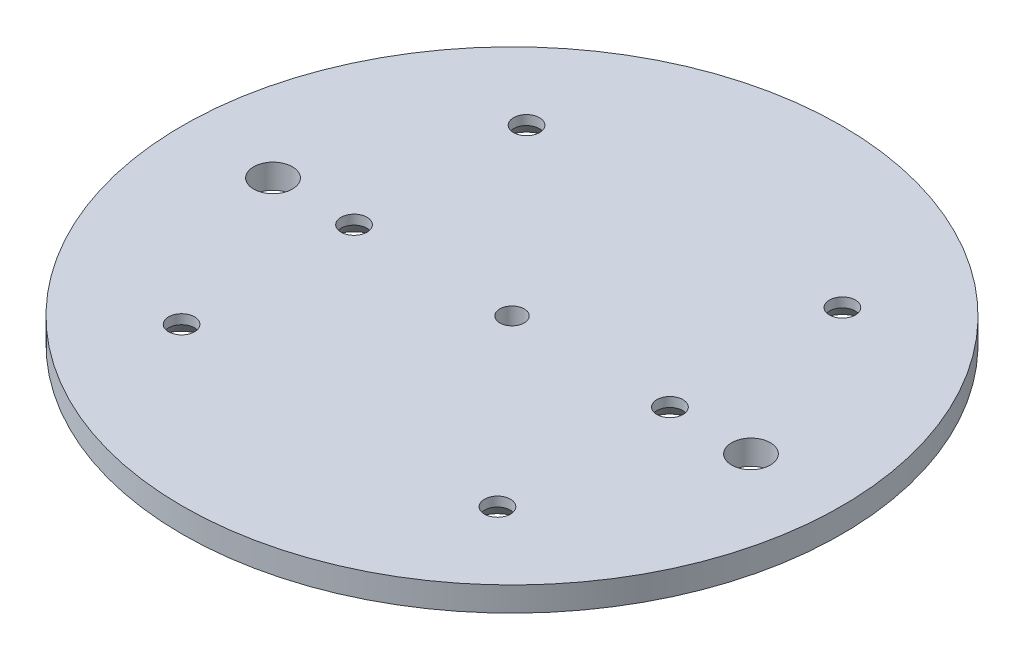
from build123d import *

# Parameters (mm, degrees)
SKETCH1_R                                    = 85.725
BOSS_EXTRUDE1_DEPTH                          = 6.35
F_3_8_CLEARANCE_HOLE1_D                      = 10.0838
F_1_4_0_25_CLEARANCE_DOWEL_HOLE1_D           = 6.35
CSK_FOR_1_4_FLAT_HEAD_SOCKET_CAP_SCR_2_COUNT = 2
CSK_FOR_1_4_FLAT_HEAD_SOCKET_CAP_SCR_2_PITCH = 89.726645959
CSK_FOR_1_4_FLAT_HEAD_SOCKET_CAP_SCR_3_COUNT = 2
CSK_FOR_1_4_FLAT_HEAD_SOCKET_CAP_SCR_3_PITCH = 44.863322979
CSK_FOR_1_4_FLAT_HEAD_SOCKET_CAP_SCR_4_COUNT = 2
CSK_FOR_1_4_FLAT_HEAD_SOCKET_CAP_SCR_4_PITCH = 82.169
CSK_FOR_1_4_FLAT_HEAD_SOCKET_CAP_SCR_5_COUNT = 2
CSK_FOR_1_4_FLAT_HEAD_SOCKET_CAP_SCR_5_PITCH = 93.61870705
CSK_FOR_1_4_FLAT_HEAD_SOCKET_CAP_SCR_6_COUNT = 2
CSK_FOR_1_4_FLAT_HEAD_SOCKET_CAP_SCR_6_PITCH = 121.666


with BuildPart() as part:
    # Sketch1 → Boss-Extrude1 (new body)
    with BuildSketch(Plane(origin=(0, 0, 0), x_dir=(1, 0, 0), z_dir=(0, 1, 0))):
        Circle(SKETCH1_R)
    extrude(amount=BOSS_EXTRUDE1_DEPTH)

    # 3/8 Clearance Hole1 (through all)
    with Locations(Plane(origin=(0, 6.35, 0), x_dir=(0.9997060077974086, 0, 0.024246607469250614), z_dir=(0, 1, 0))):
        with Locations((-62.148223534, -1.507326723), (62.148223534, 1.507326723)):
            Hole(F_3_8_CLEARANCE_HOLE1_D / 2)

    # 1/4 (0.25) Clearance Dowel Hole1 (through all)
    with Locations(Plane(origin=(43.377433792, 6.35, -259.284531313), x_dir=(0.9888467421616725, 0, -0.14893663255306588), z_dir=(0, 1, 0))):
        with Locations((-81.510599056, -249.932175164)):
            Hole(F_1_4_0_25_CLEARANCE_DOWEL_HOLE1_D / 2)

    # Sketch11 → CSK for 1/4 Flat Head Socket Cap Screw1 (revolve, cut)
    with BuildSketch(Plane(origin=(41.0845, 0, -44.863322979), x_dir=(0, 0, -1), z_dir=(1, 0, 0))):
        Polygon((0, 0), (0, 6.35), (3.3782, 6.35), (3.3782, 3.871564875), (6.7437, 0), align=None)
    csk_for_1_4_flat_head_socket_cap_screw1 = revolve(axis=Axis((41.0845, -6.35, -44.863322979), (0, 1, 0)), mode=Mode.SUBTRACT)

    # CSK for 1_4 Flat Head Socket Cap Scr 2: CSK for 1/4 Flat Head Socket Cap Screw1 ×2
    with Locations(*[(0, 0, i * CSK_FOR_1_4_FLAT_HEAD_SOCKET_CAP_SCR_2_PITCH) for i in range(1, CSK_FOR_1_4_FLAT_HEAD_SOCKET_CAP_SCR_2_COUNT)]):
        add(csk_for_1_4_flat_head_socket_cap_screw1, mode=Mode.SUBTRACT)

    # CSK for 1_4 Flat Head Socket Cap Scr 3: CSK for 1/4 Flat Head Socket Cap Screw1 ×2
    with Locations(*[(0, 0, i * CSK_FOR_1_4_FLAT_HEAD_SOCKET_CAP_SCR_3_PITCH) for i in range(1, CSK_FOR_1_4_FLAT_HEAD_SOCKET_CAP_SCR_3_COUNT)]):
        add(csk_for_1_4_flat_head_socket_cap_screw1, mode=Mode.SUBTRACT)

    # CSK for 1_4 Flat Head Socket Cap Scr 4: CSK for 1/4 Flat Head Socket Cap Screw1 ×2
    with Locations(*[(-i * CSK_FOR_1_4_FLAT_HEAD_SOCKET_CAP_SCR_4_PITCH, 0, 0) for i in range(1, CSK_FOR_1_4_FLAT_HEAD_SOCKET_CAP_SCR_4_COUNT)]):
        add(csk_for_1_4_flat_head_socket_cap_screw1, mode=Mode.SUBTRACT)

    # CSK for 1_4 Flat Head Socket Cap Scr 5: CSK for 1/4 Flat Head Socket Cap Screw1 ×2
    with Locations(*[Vector(-0.8776985133513366, 0, 0.47921322984747994) * (i * CSK_FOR_1_4_FLAT_HEAD_SOCKET_CAP_SCR_5_PITCH) for i in range(1, CSK_FOR_1_4_FLAT_HEAD_SOCKET_CAP_SCR_5_COUNT)]):
        add(csk_for_1_4_flat_head_socket_cap_screw1, mode=Mode.SUBTRACT)

    # CSK for 1_4 Flat Head Socket Cap Scr 6: CSK for 1/4 Flat Head Socket Cap Screw1 ×2
    with Locations(*[Vector(-0.6753653444645643, 0, 0.7374833228597514) * (i * CSK_FOR_1_4_FLAT_HEAD_SOCKET_CAP_SCR_6_PITCH) for i in range(1, CSK_FOR_1_4_FLAT_HEAD_SOCKET_CAP_SCR_6_COUNT)]):
        add(csk_for_1_4_flat_head_socket_cap_screw1, mode=Mode.SUBTRACT)


solid = part.part
